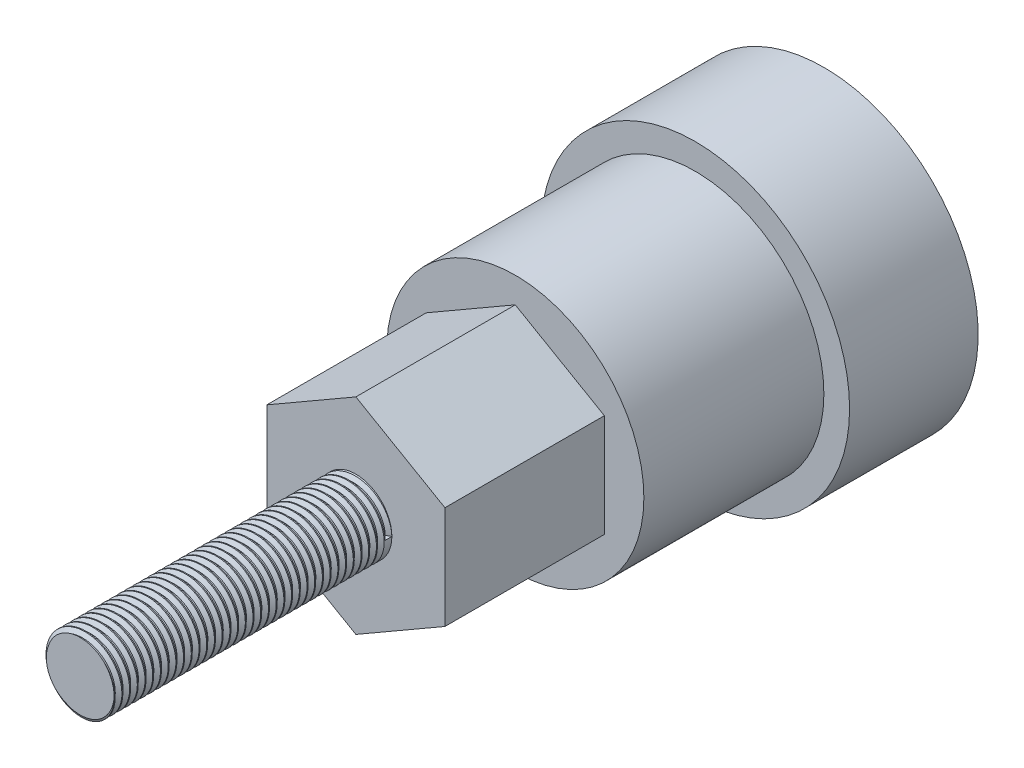
from build123d import *

# Parameters (mm, degrees)
SKETCH1_R           = 30
BOSS_EXTRUDE1_DEPTH = 40
SKETCH13_R          = 25
BOSS_EXTRUDE7_DEPTH = 35
BOSS_EXTRUDE8_DEPTH = 31
SKETCH15_R          = 7
BOSS_EXTRUDE9_DEPTH = 54
SKETCH16_R          = 37.21640111
CUT_EXTRUDE2_DEPTH  = 15
THREAD1_PITCH       = 1.5


with BuildPart() as part:
    # Sketch1 → Boss-Extrude1 (new body)
    with BuildSketch(Plane.XY):
        Circle(SKETCH1_R)
    extrude(amount=BOSS_EXTRUDE1_DEPTH)

    # Sketch13 → Boss-Extrude7 (add)
    with BuildSketch(Plane.XY.offset(40)):
        Circle(SKETCH13_R)
    extrude(amount=BOSS_EXTRUDE7_DEPTH)

    # Sketch14 → Boss-Extrude8 (add)
    with BuildSketch(Plane.XY.offset(75)):
        Polygon((0, 20), (-17.320508076, 10), (-17.320508076, -10), (0, -20), (17.320508076, -10), (17.320508076, 10), align=None)
    extrude(amount=BOSS_EXTRUDE8_DEPTH)

    # Sketch15 → Boss-Extrude9 (add)
    with BuildSketch(Plane.XY.offset(106)):
        Circle(SKETCH15_R)
    extrude(amount=BOSS_EXTRUDE9_DEPTH)

    # Sketch16 → Cut-Extrude2 (cut)
    with BuildSketch(Plane(origin=(0, 0, 0), x_dir=(-1, 0, 0), z_dir=(0, 0, -1))):
        Circle(SKETCH16_R)
    extrude(amount=-CUT_EXTRUDE2_DEPTH, mode=Mode.SUBTRACT)

    # Thread1: the profile of Thread Profile1 profile screwed along a right-hand helix of 36 turns, 8 arcs to a turn; built about Z, then put on its axis
    thread1_z = Axis((0, 0, 0), (0, 0, 1))
    thread1_corners = [(7.0003, 0, -0.000173205), (7.0003, 0, 1.312673201), (6.188101188, 0, 0.843749998), (6.188101188, 0, 0.468749998)]
    with BuildLine(mode=Mode.PRIVATE) as thread1_profile:
        Line(thread1_corners[0], thread1_corners[1])
        Line(thread1_corners[1], thread1_corners[2])
        Line(thread1_corners[2], thread1_corners[3])
        Line(thread1_corners[3], thread1_corners[0])
    thread1_cap = Face(thread1_profile.wire())
    thread1_turn_angles = [0, 22.5, 45, 67.5, 90, 112.5, 135, 157.5, 180, 202.5, 225, 247.5, 270, 292.5, 315, 337.5, 360]
    thread1_turn_weights = [1, 0.9238795325112867, 1, 0.9238795325112867, 1, 0.9238795325112867, 1, 0.9238795325112867, 1, 0.9238795325112867, 1, 0.9238795325112867, 1, 0.9238795325112867, 1, 0.9238795325112867, 1]
    thread1_turn_rails = [Edge.make_bspline([Vector(p[0], p[1], 0).rotate(thread1_z, thread1_turn_angles[k]) / thread1_turn_weights[k] + Vector(0, 0, p[2] + THREAD1_PITCH * thread1_turn_angles[k] / 360) for k in range(17)], [0, 0, 0, 1, 1, 2, 2, 3, 3, 4, 4, 5, 5, 6, 6, 7, 7, 8, 8, 8], 2, thread1_turn_weights) for p in thread1_corners]
    thread1_turn_sides = [Face.make_surface_from_curves(thread1_turn_rails[p[0]], thread1_turn_rails[p[1]]) for p in [(0, 1), (1, 2), (2, 3), (3, 0)]]
    thread1 = Plane(origin=(0, 0, 106), x_dir=(1, 0, 0), z_dir=(0, 0, 1)) * Solid(Shell([*[p.moved(Location((0, 0, THREAD1_PITCH * i))) for i in range(36) for p in thread1_turn_sides], thread1_cap, thread1_cap.rotate(thread1_z, 12960).moved(Location((0, 0, THREAD1_PITCH * 12960 / 360)))]))
    add(thread1, mode=Mode.SUBTRACT)


solid = part.part
